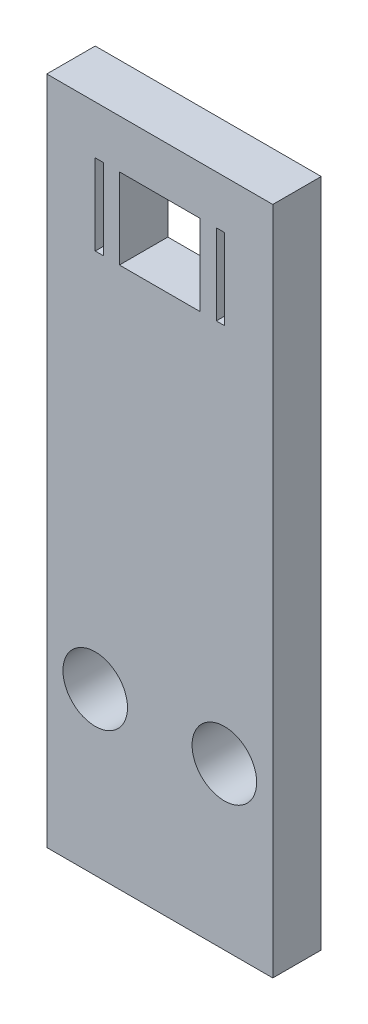
from build123d import *

# Parameters (mm, degrees)
SKETCH1_W           = 14
SKETCH1_H           = 41.5
SKETCH1_W_2         = 5
SKETCH1_H_2         = 5
SKETCH1_W_3         = 0.5
SKETCH1_R           = 2
BOSS_EXTRUDE3_DEPTH = 3


with BuildPart() as part:
    # Sketch1 → Boss-Extrude3 (new body)
    with BuildSketch(Plane.XY):
        with Locations((7, 20.75)):
            Rectangle(SKETCH1_W, SKETCH1_H)
        with Locations((7, 36)):
            Rectangle(SKETCH1_W_2, SKETCH1_H_2, mode=Mode.SUBTRACT)
        with Locations((3.25, 36)):
            Rectangle(SKETCH1_W_3, SKETCH1_H_2, mode=Mode.SUBTRACT)
        with Locations((3, 10)):
            Circle(SKETCH1_R, mode=Mode.SUBTRACT)
        with Locations((11, 10)):
            Circle(SKETCH1_R, mode=Mode.SUBTRACT)
        with Locations((10.75, 36)):
            Rectangle(SKETCH1_W_3, SKETCH1_H_2, mode=Mode.SUBTRACT)
    extrude(amount=BOSS_EXTRUDE3_DEPTH)


solid = part.part
